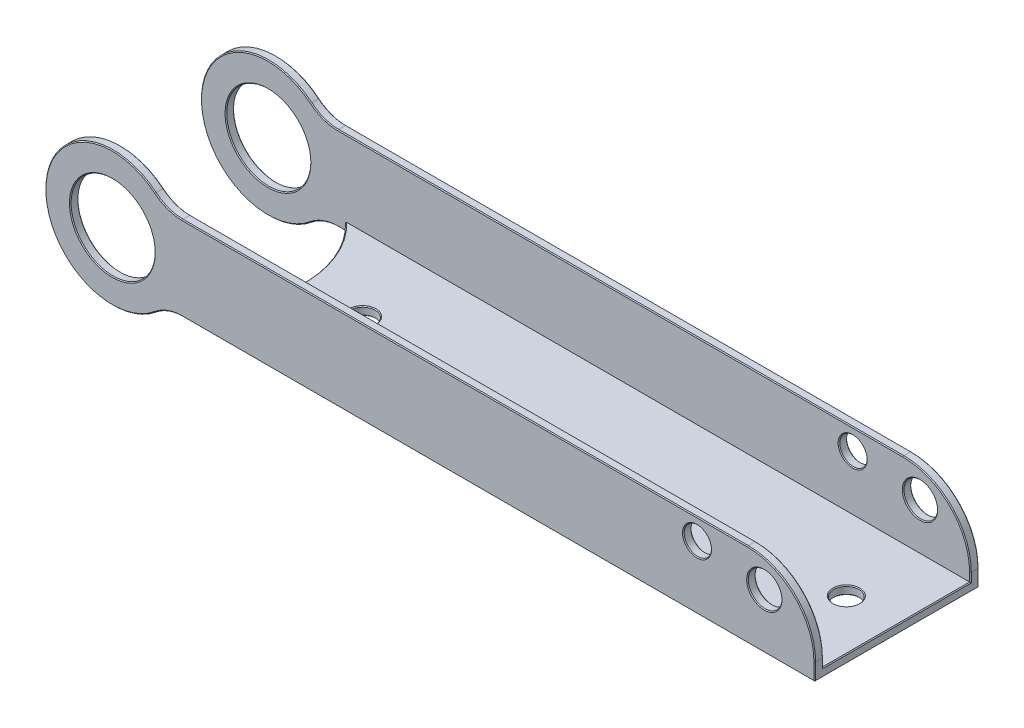
from build123d import *

# Parameters (mm, degrees)
EXTRUDE_1_DEPTH          = 19.5
FILLET_1_R               = 16
FILLET_2_R               = 10
CUT_EXTRUDE_1_DEPTH      = 169.89419765
CUT_EXTRUDE_1_DEPTH_BACK = 169.89419765
SKETCH_2_R               = 10
CUT_EXTRUDE_2_DEPTH      = 169.89419765
CUT_EXTRUDE_2_DEPTH_BACK = 169.89419765
SKETCH_4_W               = 35
SKETCH_4_H               = 18
CUT_EXTRUDE_3_DEPTH      = 169.89419765
SKETCH_5_R               = 4
SKETCH_5_R_2             = 3.25
CUT_EXTRUDE_4_DEPTH      = 173.238207143
SKETCH_6_R               = 3
CUT_EXTRUDE_5_DEPTH      = 171.133036181
CHAMFER_1_SIZE           = 0.2


with BuildPart() as part:
    # ｽｹｯﾁ1 → ﾎﾞｽ - 押し出し1 (new, symmetric)
    with BuildSketch(Plane.XY):
        with BuildLine():
            Line((12.489995997, 10), (167, 10))
            Line((167, 10), (167, -10))
            Line((167, -10), (12.489995997, -10))
            ThreePointArc((12.489995997, -10), (-16, 0), (12.489995997, 10))
        make_face()
    extrude(amount=EXTRUDE_1_DEPTH, both=True)

    # ﾌｨﾚｯﾄ1
    fillet_1_edges = [part.edges().sort_by_distance(p)[0] for p in [
        (167, 10, 0),
    ]]
    fillet(fillet_1_edges, radius=FILLET_1_R)

    # ﾌｨﾚｯﾄ2
    fillet_2_edges = [part.edges().sort_by_distance(p)[0] for p in [
        (12.489995997, -10, 0),
        (12.489995997, 10, 0),
    ]]
    fillet(fillet_2_edges, radius=FILLET_2_R)

    # ｽｹｯﾁ2 → ｶｯﾄ - 押し出し1 (cut, two sides: drawn at the far end of the back side and taken through both)
    with BuildSketch(Plane.XY.offset(-CUT_EXTRUDE_1_DEPTH_BACK)):
        Circle(SKETCH_2_R)
    extrude(amount=CUT_EXTRUDE_1_DEPTH + CUT_EXTRUDE_1_DEPTH_BACK, mode=Mode.SUBTRACT)

    # ｽｹｯﾁ3 → ｶｯﾄ - 押し出し2 (cut, two sides: drawn at the far end of the back side and taken through both)
    with BuildSketch(Plane(origin=(0, 0, 0), x_dir=(1, 0, 0), z_dir=(0, 1, 0)).offset(-CUT_EXTRUDE_2_DEPTH_BACK)):
        with BuildLine():
            Line((-16, 17.5), (18.424067706, 17.5))
            ThreePointArc((18.424067706, 17.5), (26, 0), (18.424067706, -17.5))
            Line((18.424067706, -17.5), (-16, -17.5))
            Line((-16, -17.5), (-16, 17.5))
        make_face()
    extrude(amount=CUT_EXTRUDE_2_DEPTH + CUT_EXTRUDE_2_DEPTH_BACK, mode=Mode.SUBTRACT)

    # ｽｹｯﾁ4 → ｶｯﾄ - 押し出し3 (cut, through all)
    with BuildSketch(Plane(origin=(0, 0, 0), x_dir=(0, 0, -1), z_dir=(1, 0, 0))):
        with Locations((0, 1)):
            Rectangle(SKETCH_4_W, SKETCH_4_H)
    extrude(amount=CUT_EXTRUDE_3_DEPTH, mode=Mode.SUBTRACT)

    # ｽｹｯﾁ5 → ｶｯﾄ - 押し出し4 (cut, through all)
    with BuildSketch(Plane.XY.offset(19.5)):
        with Locations((155, 3)):
            Circle(SKETCH_5_R)
        with Locations((139, 5)):
            Circle(SKETCH_5_R_2)
    extrude(amount=-CUT_EXTRUDE_4_DEPTH, mode=Mode.SUBTRACT)

    # ｽｹｯﾁ6 → ｶｯﾄ - 押し出し5 (cut, through all)
    with BuildSketch(Plane.XZ.offset(10)):
        with Locations((155, 0)):
            Circle(SKETCH_6_R)
        with Locations((40, 0)):
            Circle(SKETCH_6_R)
    extrude(amount=-CUT_EXTRUDE_5_DEPTH, mode=Mode.SUBTRACT)

    # 面取り1
    chamfer_1_edges = [part.edges().sort_by_distance(p)[0] for p in [
        (135.75, 5, 19.5),
        (135.75, 5, 17.5),
        (151, 3, 19.5),
        (151, 3, 17.5),
        (135.75, 5, -17.5),
        (135.75, 5, -19.5),
        (151, 3, -17.5),
        (151, 3, -19.5),
        (-10, 0, 19.5),
        (-10, 0, 17.5),
        (-10, 0, -17.5),
        (-10, 0, -19.5),
        (17.518657716, -10, -17.5),
        (13.216416623, -10.594600569, -17.5),
        (-16, 0, -17.5),
        (13.216416623, 10.594600569, -17.5),
        (83.806623863, 10, -17.5),
        (167, -7, -17.5),
        (162.313708499, 5.313708499, -17.5),
        (17.518657716, -10, 17.5),
        (13.216416623, -10.594600569, 17.5),
        (-16, 0, 17.5),
        (13.216416623, 10.594600569, 17.5),
        (167, -7, 17.5),
        (83.806623863, 10, 17.5),
        (162.313708499, 5.313708499, 17.5),
        (167, -8, 0),
        (167, -8, 19.5),
        (167, -8, -19.5),
        (162.313708499, 5.313708499, 19.5),
        (162.313708499, 5.313708499, -19.5),
        (83.806623863, 10, 19.5),
        (83.806623863, 10, -19.5),
        (13.216416623, 10.594600569, 19.5),
        (13.216416623, 10.594600569, -19.5),
        (-16, 0, 19.5),
        (-16, 0, -19.5),
        (13.216416623, -10.594600569, 19.5),
        (13.216416623, -10.594600569, -19.5),
        (91.806623863, -10, 19.5),
        (167, -10, 0),
        (91.806623863, -10, -19.5),
        (152, -10, 0),
        (152, -8, 0),
        (37, -10, 0),
        (37, -8, 0),
        (26, -10, 0),
        (26, -8, 0),
    ]]
    chamfer(chamfer_1_edges, length=CHAMFER_1_SIZE)


solid = part.part
